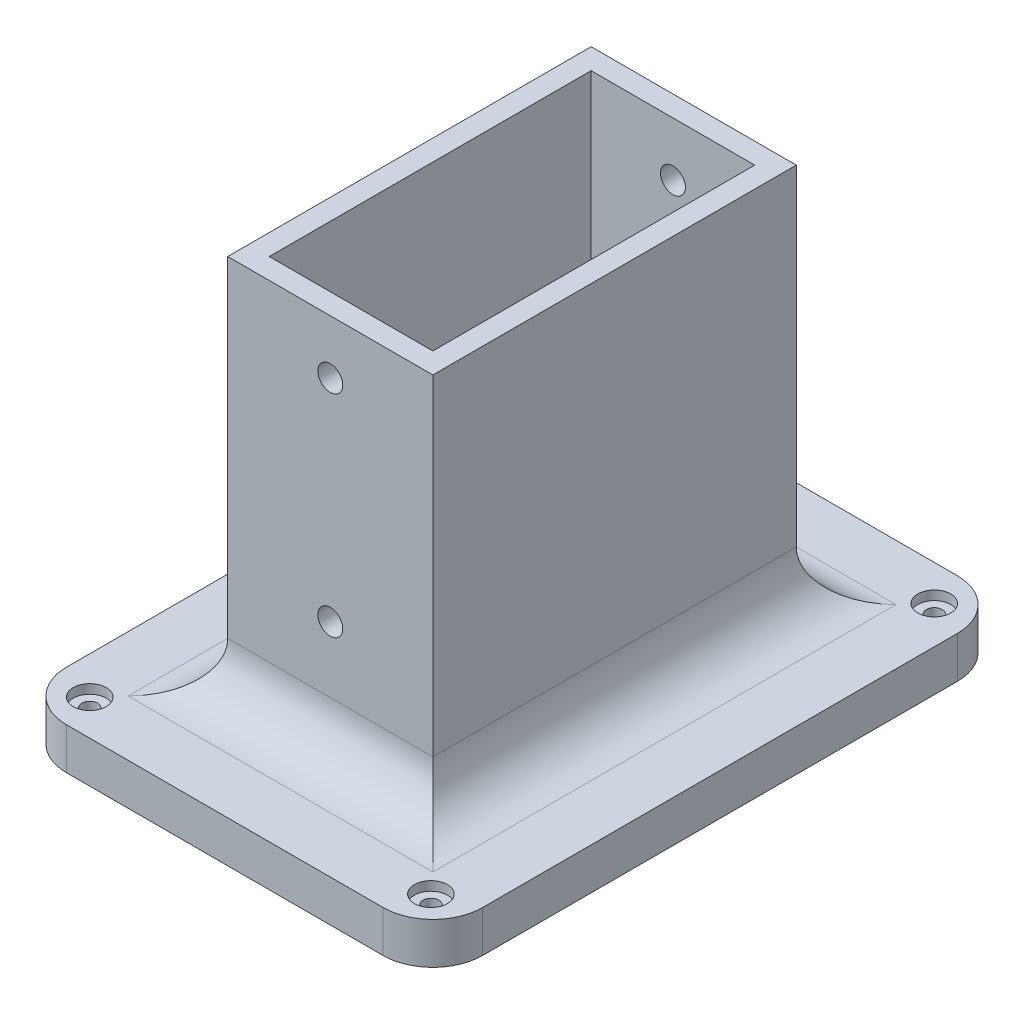
from build123d import *

# Parameters (mm, degrees)
SKETCH1_W                                     = 49.37
SKETCH1_H                                     = 87.47
SKETCH1_W_2                                   = 39.37
SKETCH1_H_2                                   = 77.47
BOSS_EXTRUDE1_DEPTH                           = 101.6
SKETCH2_W                                     = 100.17
SKETCH2_H                                     = 138.27
BOSS_EXTRUDE2_DEPTH                           = 10
FILLET1_R                                     = 12
CBORE_FOR_6_BINDING_HEAD_MACHINE_SC_2_R       = 1.89865
CBORE_FOR_6_BINDING_HEAD_MACHINE_SCREW2_DEPTH = 10
CBORE_START                                   = 7.7902
CBORE_FOR_6_BINDING_HEAD_MACHINE_SC_3_O_R     = 3.96875
CBORE_FOR_6_BINDING_HEAD_MACHINE_SC_3_O_R_2   = 1.89865
CBORE_FOR_6_BINDING_HEAD_MACHINE_SC_3_DEPTH   = 2.2098
FILLET2_R                                     = 12
SKETCH9_R                                     = 3
CUT_EXTRUDE1_DEPTH                            = 160.908424184


# Read off the part's stored shape, not the designer's step: CBORE for #6 Binding Head Machine Screw2
with BuildPart() as part:
    # Sketch1 → Boss-Extrude1 (new body)
    with BuildSketch(Plane(origin=(0, 0, 0), x_dir=(1, 0, 0), z_dir=(0, 1, 0))):
        Rectangle(SKETCH1_W, SKETCH1_H)
        Rectangle(SKETCH1_W_2, SKETCH1_H_2, mode=Mode.SUBTRACT)
    extrude(amount=BOSS_EXTRUDE1_DEPTH)

    # Sketch2 → Boss-Extrude2 (add)
    with BuildSketch(Plane(origin=(0, 0, 0), x_dir=(1, 0, 0), z_dir=(0, 1, 0))):
        Rectangle(SKETCH2_W, SKETCH2_H)
    extrude(amount=BOSS_EXTRUDE2_DEPTH)

    # Fillet1
    fillet1_edges = [part.edges().sort_by_distance(p)[0] for p in [
        (0, 10, -43.735),
        (24.685, 10, 0),
        (0, 10, 43.735),
        (-24.685, 10, 0),
    ]]
    fillet(fillet1_edges, radius=FILLET1_R)

    # CBORE for _6 Binding Head Machine Sc 2 → CBORE for #6 Binding Head Machine Screw2 (cut)
    with BuildSketch(Plane(origin=(0, 0, 0), x_dir=(1, 0, 0), z_dir=(0, 1, 0))):
        with Locations((41.060456563, -60.576250035)):
            Circle(CBORE_FOR_6_BINDING_HEAD_MACHINE_SC_2_R)
        with Locations((-41.060456563, 60.576250035)):
            Circle(CBORE_FOR_6_BINDING_HEAD_MACHINE_SC_2_R)
        with Locations((-41.060456563, -60.576250035)):
            Circle(CBORE_FOR_6_BINDING_HEAD_MACHINE_SC_2_R)
        with Locations((41.060456563, 60.576250035)):
            Circle(CBORE_FOR_6_BINDING_HEAD_MACHINE_SC_2_R)
        Circle(CBORE_FOR_6_BINDING_HEAD_MACHINE_SC_2_R)
    extrude(amount=CBORE_FOR_6_BINDING_HEAD_MACHINE_SCREW2_DEPTH, mode=Mode.SUBTRACT)

    # CBORE for _6 Binding Head Machine Sc 3 o → CBORE for _6 Binding Head Machine Sc 3 (cut)
    # profile 1 of 5: a face of its own
    with BuildSketch(Plane(origin=(0, 0, 0), x_dir=(1, 0, 0), z_dir=(0, 1, 0)).offset(CBORE_START)):
        with Locations((41.060456563, -60.576250035)):
            Circle(CBORE_FOR_6_BINDING_HEAD_MACHINE_SC_3_O_R)
        with Locations((41.060456563, -60.576250035)):
            Circle(CBORE_FOR_6_BINDING_HEAD_MACHINE_SC_3_O_R_2, mode=Mode.SUBTRACT)
    # profile 2 of 5: a face of its own
    with BuildSketch(Plane(origin=(0, 0, 0), x_dir=(1, 0, 0), z_dir=(0, 1, 0)).offset(CBORE_START)):
        with Locations((-41.060456563, 60.576250035)):
            Circle(CBORE_FOR_6_BINDING_HEAD_MACHINE_SC_3_O_R)
        with Locations((-41.060456563, 60.576250035)):
            Circle(CBORE_FOR_6_BINDING_HEAD_MACHINE_SC_3_O_R_2, mode=Mode.SUBTRACT)
    # profile 3 of 5: a face of its own
    with BuildSketch(Plane(origin=(0, 0, 0), x_dir=(1, 0, 0), z_dir=(0, 1, 0)).offset(CBORE_START)):
        with Locations((-41.060456563, -60.576250035)):
            Circle(CBORE_FOR_6_BINDING_HEAD_MACHINE_SC_3_O_R)
        with Locations((-41.060456563, -60.576250035)):
            Circle(CBORE_FOR_6_BINDING_HEAD_MACHINE_SC_3_O_R_2, mode=Mode.SUBTRACT)
    # profile 4 of 5: a face of its own
    with BuildSketch(Plane(origin=(0, 0, 0), x_dir=(1, 0, 0), z_dir=(0, 1, 0)).offset(CBORE_START)):
        with Locations((41.060456563, 60.576250035)):
            Circle(CBORE_FOR_6_BINDING_HEAD_MACHINE_SC_3_O_R)
        with Locations((41.060456563, 60.576250035)):
            Circle(CBORE_FOR_6_BINDING_HEAD_MACHINE_SC_3_O_R_2, mode=Mode.SUBTRACT)
    # profile 5 of 5: a face of its own
    with BuildSketch(Plane(origin=(0, 0, 0), x_dir=(1, 0, 0), z_dir=(0, 1, 0)).offset(CBORE_START)):
        Circle(CBORE_FOR_6_BINDING_HEAD_MACHINE_SC_3_O_R)
        Circle(CBORE_FOR_6_BINDING_HEAD_MACHINE_SC_3_O_R_2, mode=Mode.SUBTRACT)
    extrude(amount=CBORE_FOR_6_BINDING_HEAD_MACHINE_SC_3_DEPTH, mode=Mode.SUBTRACT)

    # Fillet2
    fillet2_edges = [part.edges().sort_by_distance(p)[0] for p in [
        (50.085, 5, 69.135),
        (50.085, 5, -69.135),
        (-50.085, 5, -69.135),
        (-50.085, 5, 69.135),
    ]]
    fillet(fillet2_edges, radius=FILLET2_R)

    # Sketch9 → Cut-Extrude1 (cut, through all)
    with BuildSketch(Plane.XY.offset(43.735)):
        with Locations((0, 88.608727906)):
            Circle(SKETCH9_R)
        with Locations((0, 37.808727906)):
            Circle(SKETCH9_R)
    extrude(amount=-CUT_EXTRUDE1_DEPTH, mode=Mode.SUBTRACT)


solid = part.part
